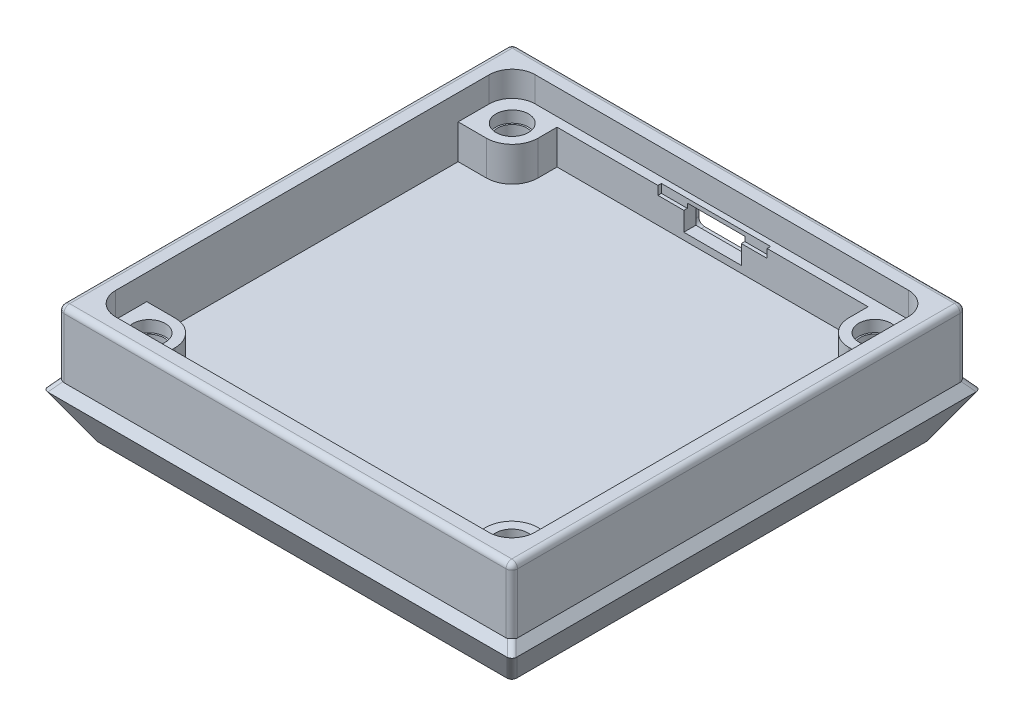
from build123d import *

# Parameters (mm, degrees)
SKETCH1_W               = 72.88
SKETCH1_H               = 72.95
SKETCH1_W_2             = 69.08
SKETCH1_H_2             = 69.15
FLOOR_2_DEPTH           = 10
SKETCH3_W               = 78.88
SKETCH3_H               = 78.95
SKETCH3_W_2             = 72.88
SKETCH3_H_2             = 72.95
WALLS_FROM_BOTTOM_DEPTH = 20.4
SKETCH4_R               = 2.55
BOSS_EXTRUDE1_DEPTH     = 6
SKETCH21_R              = 2.825
CUT_EXTRUDE9_DEPTH      = 2
SKETCH7_W               = 54.075
SKETCH7_H               = 1.6
BOSS_EXTRUDE2_DEPTH     = 6
CUT_EXTRUDE1_DEPTH      = 4.8
CUT_EXTRUDE2_DEPTH      = 88.977702289
SKETCH10_W              = 4.5
SKETCH10_H              = 1.6
CUT_EXTRUDE3_DEPTH      = 1.5
CUT_EXTRUDE4_DEPTH      = 2.5
BOSS_EXTRUDE7_DEPTH     = 87
SKETCH17_W              = 3.751503991
SKETCH17_H              = 9
BOSS_EXTRUDE8_DEPTH     = 91.658299628
CUT_EXTRUDE7_DEPTH      = 105.065434863
CUT_EXTRUDE7_DEPTH_BACK = 105.065434863
CUT_EXTRUDE8_DEPTH      = 96.400760349
CUT_EXTRUDE8_DEPTH_BACK = 96.400760349
FILLET1_R               = 4
FILLET2_R               = 1
FILLET3_R               = 1
BOSS_EXTRUDE9_DEPTH     = 1


with BuildPart() as part:
    # Sketch1 → floor 2 (new body)
    # profile 1 of 2: a face of its own
    with BuildSketch(Plane(origin=(0, 0, 0), x_dir=(1, 0, 0), z_dir=(0, 1, 0))):
        Rectangle(SKETCH1_W, SKETCH1_H)
        Rectangle(SKETCH1_W_2, SKETCH1_H_2, mode=Mode.SUBTRACT)
    # profile 2 of 2: a face of its own
    with BuildSketch(Plane(origin=(0, 0, 0), x_dir=(1, 0, 0), z_dir=(0, 1, 0))):
        Rectangle(SKETCH1_W_2, SKETCH1_H_2)
    extrude(amount=FLOOR_2_DEPTH)

    # Sketch3 → walls from bottom (add)
    with BuildSketch(Plane.XZ):
        Rectangle(SKETCH3_W, SKETCH3_H)
        Rectangle(SKETCH3_W_2, SKETCH3_H_2, mode=Mode.SUBTRACT)
    extrude(amount=-WALLS_FROM_BOTTOM_DEPTH)

    # Sketch4 → Boss-Extrude1 (add)
    # profile 1 of 4: a face of its own
    with BuildSketch(Plane(origin=(0, 10, 0), x_dir=(1, 0, 0), z_dir=(0, 1, 0))):
        with BuildLine():
            Line((-27.0375, -36.475), (-27.0375, -31.575))
            ThreePointArc((-27.0375, -31.575), (-28.355519485, -28.393019485), (-31.5375, -27.075))
            Line((-31.5375, -27.075), (-36.44, -27.075))
            Line((-36.44, -27.075), (-36.44, -36.475))
            Line((-36.44, -36.475), (-27.0375, -36.475))
        make_face()
        with Locations(Location((-31.5375, -31.575, 0), (0, 0, 270))):
            Circle(SKETCH4_R, mode=Mode.SUBTRACT)
    # profile 2 of 4: a face of its own
    with BuildSketch(Plane(origin=(0, 10, 0), x_dir=(1, 0, 0), z_dir=(0, 1, 0))):
        with BuildLine():
            Line((-27.0375, 31.575), (-27.0375, 36.475))
            Line((-27.0375, 36.475), (-36.44, 36.475))
            Line((-36.44, 36.475), (-36.44, 27.075))
            Line((-36.44, 27.075), (-31.5375, 27.075))
            ThreePointArc((-31.5375, 27.075), (-28.355519485, 28.393019485), (-27.0375, 31.575))
        make_face()
        with Locations(Location((-31.5375, 31.575, 0), (0, 0, 270))):
            Circle(SKETCH4_R, mode=Mode.SUBTRACT)
    # profile 3 of 4: a face of its own
    with BuildSketch(Plane(origin=(0, 10, 0), x_dir=(1, 0, 0), z_dir=(0, 1, 0))):
        with BuildLine():
            Line((36.44, -27.075), (31.5375, -27.075))
            ThreePointArc((31.5375, -27.075), (28.355519485, -28.393019485), (27.0375, -31.575))
            Line((27.0375, -31.575), (27.0375, -36.475))
            Line((27.0375, -36.475), (36.44, -36.475))
            Line((36.44, -36.475), (36.44, -27.075))
        make_face()
        with Locations(Location((31.5375, -31.575, 0), (0, 0, 270))):
            Circle(SKETCH4_R, mode=Mode.SUBTRACT)
    # profile 4 of 4: a face of its own
    with BuildSketch(Plane(origin=(0, 10, 0), x_dir=(1, 0, 0), z_dir=(0, 1, 0))):
        with BuildLine():
            Line((31.5375, 27.075), (36.44, 27.075))
            Line((36.44, 27.075), (36.44, 36.475))
            Line((36.44, 36.475), (27.0375, 36.475))
            Line((27.0375, 36.475), (27.0375, 31.575))
            ThreePointArc((27.0375, 31.575), (28.355519485, 28.393019485), (31.5375, 27.075))
        make_face()
        with Locations(Location((31.5375, 31.575, 0), (0, 0, 270))):
            Circle(SKETCH4_R, mode=Mode.SUBTRACT)
    extrude(amount=BOSS_EXTRUDE1_DEPTH)

    # Sketch21 → Cut-Extrude9 (cut)
    with BuildSketch(Plane(origin=(0, 16, 0), x_dir=(1, 0, 0), z_dir=(0, 1, 0))):
        with Locations(Location((-31.5375, 31.575, 0), (0, 0, 270))):
            Circle(SKETCH21_R)
        with Locations(Location((31.5375, 31.575, 0), (0, 0, 270))):
            Circle(SKETCH21_R)
        with Locations(Location((-31.5375, -31.575, 0), (0, 0, 270))):
            Circle(SKETCH21_R)
        with Locations(Location((31.5375, -31.575, 0), (0, 0, 270))):
            Circle(SKETCH21_R)
    extrude(amount=-CUT_EXTRUDE9_DEPTH, mode=Mode.SUBTRACT)

    # Sketch7 → Boss-Extrude2 (add)
    with BuildSketch(Plane(origin=(0, 16, 0), x_dir=(1, 0, 0), z_dir=(0, 1, 0))):
        with Locations((0, 35.675)):
            Rectangle(SKETCH7_W, SKETCH7_H)
    extrude(amount=-BOSS_EXTRUDE2_DEPTH)

    # Sketch8 → Cut-Extrude1 (cut)
    with BuildSketch(Plane(origin=(0, 16, 0), x_dir=(1, 0, 0), z_dir=(0, 1, 0))):
        Polygon((0, 34.875), (-5, 34.875), (-5, 36.475), (0, 36.475), (5, 36.475), (5, 34.875), align=None)
    extrude(amount=-CUT_EXTRUDE1_DEPTH, mode=Mode.SUBTRACT)

    # Sketch9 → Cut-Extrude2 (cut, through all)
    with BuildSketch(Plane.XY.offset(-36.475)):
        Polygon((0, 15.3), (-5, 15.3), (-5, 11.2), (5, 11.2), (5, 15.3), align=None)
    extrude(amount=-CUT_EXTRUDE2_DEPTH, mode=Mode.SUBTRACT)

    # Sketch10 → Cut-Extrude3 (cut)
    with BuildSketch(Plane(origin=(0, 16, 0), x_dir=(1, 0, 0), z_dir=(0, 1, 0))):
        with Locations((-7.25, 35.675)):
            Rectangle(SKETCH10_W, SKETCH10_H)
        with Locations((7.25, 35.675)):
            Rectangle(SKETCH10_W, SKETCH10_H)
    extrude(amount=-CUT_EXTRUDE3_DEPTH, mode=Mode.SUBTRACT)

    # Sketch11 → Cut-Extrude4 (cut)
    with BuildSketch(Plane(origin=(0, 0, -39.475), x_dir=(-1, 0, 0), z_dir=(0, 0, -1))):
        with BuildLine():
            Line((-6, 17.25), (6, 17.25))
            ThreePointArc((6, 17.25), (6.707106781, 16.957106781), (7, 16.25))
            Line((7, 16.25), (7, 10.25))
            ThreePointArc((7, 10.25), (6.707106781, 9.542893219), (6, 9.25))
            Line((6, 9.25), (-6, 9.25))
            ThreePointArc((-6, 9.25), (-6.707106781, 9.542893219), (-7, 10.25))
            Line((-7, 10.25), (-7, 16.25))
            ThreePointArc((-7, 16.25), (-6.707106781, 16.957106781), (-6, 17.25))
        make_face()
    extrude(amount=-CUT_EXTRUDE4_DEPTH, mode=Mode.SUBTRACT)

    # Sketch16 → Boss-Extrude7 (add)
    with BuildSketch(Plane(origin=(0, 0, -39.475), x_dir=(-1, 0, 0), z_dir=(0, 0, -1))):
        Polygon((-39.44, 9), (-46.664968194, 9), (-46.664968194, 0), (44.993331434, 0), (44.993331434, 9), align=None)
    extrude(amount=-BOSS_EXTRUDE7_DEPTH)

    # Sketch17 → Boss-Extrude8 (add)
    with BuildSketch(Plane(origin=(46.664968194, 0, 0), x_dir=(0, 0, -1), z_dir=(1, 0, 0))):
        with Locations((41.350751996, 4.5)):
            Rectangle(SKETCH17_W, SKETCH17_H)
    extrude(amount=-BOSS_EXTRUDE8_DEPTH)

    # Sketch19 → Cut-Extrude7 (cut, two sides: drawn at the far end of the back side and taken through both)
    with BuildSketch(Plane(origin=(0, 0, -43.226503991), x_dir=(-1, 0, 0), z_dir=(0, 0, -1)).offset(-CUT_EXTRUDE7_DEPTH_BACK)):
        Polygon((-39.44, 9), (-40.725575219, 7.467911114), (-36.413974728, 0), (-50.627320284, 0), (-50.627320284, 9), align=None)
        Polygon((39.44, 9), (40.725575219, 7.467911114), (36.413974728, 0), (59.328992784, 0), (59.328992784, 9), align=None)
    extrude(amount=CUT_EXTRUDE7_DEPTH + CUT_EXTRUDE7_DEPTH_BACK, mode=Mode.SUBTRACT)

    # Sketch20 → Cut-Extrude8 (cut, two sides: drawn at the far end of the back side and taken through both)
    with BuildSketch(Plane(origin=(39.44, 0, 0), x_dir=(0, 0, -1), z_dir=(1, 0, 0)).offset(-CUT_EXTRUDE8_DEPTH_BACK)):
        Polygon((-39.475, 9), (-40.760575219, 7.467911114), (-36.448974728, 0), (-51.446524264, 0), (-51.446524264, 9), align=None)
        Polygon((39.475, 9), (40.760575219, 7.467911114), (36.448974728, 0), (51.519098664, 0), (51.519098664, 9), align=None)
    extrude(amount=CUT_EXTRUDE8_DEPTH + CUT_EXTRUDE8_DEPTH_BACK, mode=Mode.SUBTRACT)

    # Fillet1
    fillet1_edges = [part.edges().sort_by_distance(p)[0] for p in [
        (36.44, 18.2, -36.475),
        (-36.44, 18.2, -36.475),
        (-36.44, 18.2, 36.475),
        (36.44, 18.2, 36.475),
    ]]
    fillet(fillet1_edges, radius=FILLET1_R)

    # Fillet2
    # the kernel refuses this fillet: 1 mm, written as the material it takes off along each edge
    with BuildSketch(Plane(origin=(39.44, 6.5, 39.475), x_dir=(0, 0, -1), z_dir=(0, 1, 0))) as fillet2_piece_1_section:
        with BuildLine():
            CenterArc((FILLET2_R, FILLET2_R), FILLET2_R, 180, 90)
            Line((0, FILLET2_R), (0, 0))
            Line((0, 0), (FILLET2_R, 0))
        make_face()
    fillet2_piece_1 = extrude(amount=16.4, mode=Mode.PRIVATE)
    fillet2_piece_1 = split(fillet2_piece_1, bisect_by=Plane(origin=(39.053654756, 9.460428332, 39.432018042), z_dir=(-0.7660444431189769, -0.6427876096865407, 0)), keep=Keep.TOP, mode=Mode.PRIVATE)
    fillet2_piece_1 = split(fillet2_piece_1, bisect_by=Plane(origin=(38.911072473, 9.221146851, 39.289435759), z_dir=(0, 0.6427876096865407, 0.7660444431189769)), keep=Keep.TOP, mode=Mode.PRIVATE)
    add(fillet2_piece_1, mode=Mode.SUBTRACT)
    with BuildSketch(Plane(origin=(39.44, 6.5, 39.475), x_dir=(0, 0, -1), z_dir=(0, 1, 0))) as fillet2_piece_2_section:
        with BuildLine():
            CenterArc((FILLET2_R, FILLET2_R), FILLET2_R, 180, 90)
            Line((0, FILLET2_R), (0, 0))
            Line((0, 0), (FILLET2_R, 0))
        make_face()
    fillet2_piece_2 = extrude(amount=16.4, mode=Mode.PRIVATE)
    fillet2_piece_2 = split(fillet2_piece_2, bisect_by=Plane(origin=(39.254435759, 9.221146851, 38.946072473), z_dir=(0.7660444431189769, 0.6427876096865407, 0)), keep=Keep.TOP, mode=Mode.PRIVATE)
    fillet2_piece_2 = split(fillet2_piece_2, bisect_by=Plane(origin=(39.397018042, 9.460428332, 39.088654756), z_dir=(0, -0.6427876096865407, -0.7660444431189769)), keep=Keep.TOP, mode=Mode.PRIVATE)
    add(fillet2_piece_2, mode=Mode.SUBTRACT)
    with BuildSketch(Plane(origin=(39.44, 6.5, 39.475), x_dir=(0, 0, -1), z_dir=(0, 1, 0))) as fillet2_piece_3_section:
        with BuildLine():
            CenterArc((FILLET2_R, FILLET2_R), FILLET2_R, 180, 90)
            Line((0, FILLET2_R), (0, 0))
            Line((0, 0), (FILLET2_R, 0))
        make_face()
    fillet2_piece_3 = extrude(amount=16.4, mode=Mode.PRIVATE)
    fillet2_piece_3 = split(fillet2_piece_3, bisect_by=Plane(origin=(35.814942062, 13.32017582, 39.250250579), z_dir=(0.7660444431189769, 0.6427876096865407, 0)), keep=Keep.TOP, mode=Mode.PRIVATE)
    fillet2_piece_3 = split(fillet2_piece_3, bisect_by=Plane(origin=(39.215250579, 13.32017582, 35.849942062), z_dir=(0, 0.6427876096865407, 0.7660444431189769)), keep=Keep.TOP, mode=Mode.PRIVATE)
    add(fillet2_piece_3, mode=Mode.SUBTRACT)
    with BuildSketch(Plane(origin=(39.44, 6.5, -39.475), x_dir=(-1, 0, 0), z_dir=(0, 1, 0))) as fillet2_piece_4_section:
        with BuildLine():
            CenterArc((FILLET2_R, FILLET2_R), FILLET2_R, 180, 90)
            Line((0, FILLET2_R), (0, 0))
            Line((0, 0), (FILLET2_R, 0))
        make_face()
    fillet2_piece_4 = extrude(amount=16.4, mode=Mode.PRIVATE)
    fillet2_piece_4 = split(fillet2_piece_4, bisect_by=Plane(origin=(39.397018042, 9.460428332, -39.088654756), z_dir=(0, -0.6427876096865407, 0.7660444431189769)), keep=Keep.TOP, mode=Mode.PRIVATE)
    fillet2_piece_4 = split(fillet2_piece_4, bisect_by=Plane(origin=(39.254435759, 9.221146851, -38.946072473), z_dir=(0.7660444431189769, 0.6427876096865407, 0)), keep=Keep.TOP, mode=Mode.PRIVATE)
    add(fillet2_piece_4, mode=Mode.SUBTRACT)
    with BuildSketch(Plane(origin=(39.44, 6.5, -39.475), x_dir=(-1, 0, 0), z_dir=(0, 1, 0))) as fillet2_piece_5_section:
        with BuildLine():
            CenterArc((FILLET2_R, FILLET2_R), FILLET2_R, 180, 90)
            Line((0, FILLET2_R), (0, 0))
            Line((0, 0), (FILLET2_R, 0))
        make_face()
    fillet2_piece_5 = extrude(amount=16.4, mode=Mode.PRIVATE)
    fillet2_piece_5 = split(fillet2_piece_5, bisect_by=Plane(origin=(38.911072473, 9.221146851, -39.289435759), z_dir=(0, 0.6427876096865407, -0.7660444431189769)), keep=Keep.TOP, mode=Mode.PRIVATE)
    fillet2_piece_5 = split(fillet2_piece_5, bisect_by=Plane(origin=(39.053654756, 9.460428332, -39.432018042), z_dir=(-0.7660444431189769, -0.6427876096865407, 0)), keep=Keep.TOP, mode=Mode.PRIVATE)
    add(fillet2_piece_5, mode=Mode.SUBTRACT)
    with BuildSketch(Plane(origin=(39.44, 6.5, -39.475), x_dir=(-1, 0, 0), z_dir=(0, 1, 0))) as fillet2_piece_6_section:
        with BuildLine():
            CenterArc((FILLET2_R, FILLET2_R), FILLET2_R, 180, 90)
            Line((0, FILLET2_R), (0, 0))
            Line((0, 0), (FILLET2_R, 0))
        make_face()
    fillet2_piece_6 = extrude(amount=16.4, mode=Mode.PRIVATE)
    fillet2_piece_6 = split(fillet2_piece_6, bisect_by=Plane(origin=(39.215250579, 13.32017582, -35.849942062), z_dir=(0, 0.6427876096865407, -0.7660444431189769)), keep=Keep.TOP, mode=Mode.PRIVATE)
    fillet2_piece_6 = split(fillet2_piece_6, bisect_by=Plane(origin=(35.814942062, 13.32017582, -39.250250579), z_dir=(0.7660444431189769, 0.6427876096865407, 0)), keep=Keep.TOP, mode=Mode.PRIVATE)
    add(fillet2_piece_6, mode=Mode.SUBTRACT)
    with BuildSketch(Plane(origin=(-39.44, 6.5, -39.475), x_dir=(1, 0, 0), z_dir=(0, 1, 0))) as fillet2_piece_7_section:
        with BuildLine():
            CenterArc((FILLET2_R, -FILLET2_R), FILLET2_R, 90, 90)
            Line((0, -FILLET2_R), (0, 0))
            Line((0, 0), (FILLET2_R, 0))
        make_face()
    fillet2_piece_7 = extrude(amount=16.4, mode=Mode.PRIVATE)
    fillet2_piece_7 = split(fillet2_piece_7, bisect_by=Plane(origin=(-39.397018042, 9.460428332, -39.088654756), z_dir=(0, -0.6427876096865407, 0.7660444431189769)), keep=Keep.TOP, mode=Mode.PRIVATE)
    fillet2_piece_7 = split(fillet2_piece_7, bisect_by=Plane(origin=(-39.254435759, 9.221146851, -38.946072473), z_dir=(-0.7660444431189777, 0.6427876096865398, 0)), keep=Keep.TOP, mode=Mode.PRIVATE)
    add(fillet2_piece_7, mode=Mode.SUBTRACT)
    with BuildSketch(Plane(origin=(-39.44, 6.5, -39.475), x_dir=(1, 0, 0), z_dir=(0, 1, 0))) as fillet2_piece_8_section:
        with BuildLine():
            CenterArc((FILLET2_R, -FILLET2_R), FILLET2_R, 90, 90)
            Line((0, -FILLET2_R), (0, 0))
            Line((0, 0), (FILLET2_R, 0))
        make_face()
    fillet2_piece_8 = extrude(amount=16.4, mode=Mode.PRIVATE)
    fillet2_piece_8 = split(fillet2_piece_8, bisect_by=Plane(origin=(-38.911072473, 9.221146851, -39.289435759), z_dir=(0, 0.6427876096865407, -0.7660444431189769)), keep=Keep.TOP, mode=Mode.PRIVATE)
    fillet2_piece_8 = split(fillet2_piece_8, bisect_by=Plane(origin=(-39.053654756, 9.460428332, -39.432018042), z_dir=(0.7660444431189777, -0.6427876096865398, 0)), keep=Keep.TOP, mode=Mode.PRIVATE)
    add(fillet2_piece_8, mode=Mode.SUBTRACT)
    with BuildSketch(Plane(origin=(-39.44, 6.5, -39.475), x_dir=(1, 0, 0), z_dir=(0, 1, 0))) as fillet2_piece_9_section:
        with BuildLine():
            CenterArc((FILLET2_R, -FILLET2_R), FILLET2_R, 90, 90)
            Line((0, -FILLET2_R), (0, 0))
            Line((0, 0), (FILLET2_R, 0))
        make_face()
    fillet2_piece_9 = extrude(amount=16.4, mode=Mode.PRIVATE)
    fillet2_piece_9 = split(fillet2_piece_9, bisect_by=Plane(origin=(-39.215250579, 13.32017582, -35.849942062), z_dir=(0, 0.6427876096865407, -0.7660444431189769)), keep=Keep.TOP, mode=Mode.PRIVATE)
    fillet2_piece_9 = split(fillet2_piece_9, bisect_by=Plane(origin=(-35.814942062, 13.32017582, -39.250250579), z_dir=(-0.7660444431189777, 0.6427876096865398, 0)), keep=Keep.TOP, mode=Mode.PRIVATE)
    add(fillet2_piece_9, mode=Mode.SUBTRACT)
    with BuildSketch(Plane(origin=(-39.44, 6.5, 39.475), x_dir=(1, 0, 0), z_dir=(0, 1, 0))) as fillet2_piece_10_section:
        with BuildLine():
            CenterArc((FILLET2_R, FILLET2_R), FILLET2_R, 180, 90)
            Line((0, FILLET2_R), (0, 0))
            Line((0, 0), (FILLET2_R, 0))
        make_face()
    fillet2_piece_10 = extrude(amount=16.4, mode=Mode.PRIVATE)
    fillet2_piece_10 = split(fillet2_piece_10, bisect_by=Plane(origin=(-39.397018042, 9.460428332, 39.088654756), z_dir=(0, -0.6427876096865407, -0.7660444431189769)), keep=Keep.TOP, mode=Mode.PRIVATE)
    fillet2_piece_10 = split(fillet2_piece_10, bisect_by=Plane(origin=(-39.254435759, 9.221146851, 38.946072473), z_dir=(-0.7660444431189777, 0.6427876096865398, 0)), keep=Keep.TOP, mode=Mode.PRIVATE)
    add(fillet2_piece_10, mode=Mode.SUBTRACT)
    with BuildSketch(Plane(origin=(-39.44, 6.5, 39.475), x_dir=(1, 0, 0), z_dir=(0, 1, 0))) as fillet2_piece_11_section:
        with BuildLine():
            CenterArc((FILLET2_R, FILLET2_R), FILLET2_R, 180, 90)
            Line((0, FILLET2_R), (0, 0))
            Line((0, 0), (FILLET2_R, 0))
        make_face()
    fillet2_piece_11 = extrude(amount=16.4, mode=Mode.PRIVATE)
    fillet2_piece_11 = split(fillet2_piece_11, bisect_by=Plane(origin=(-38.911072473, 9.221146851, 39.289435759), z_dir=(0, 0.6427876096865407, 0.7660444431189769)), keep=Keep.TOP, mode=Mode.PRIVATE)
    fillet2_piece_11 = split(fillet2_piece_11, bisect_by=Plane(origin=(-39.053654756, 9.460428332, 39.432018042), z_dir=(0.7660444431189777, -0.6427876096865398, 0)), keep=Keep.TOP, mode=Mode.PRIVATE)
    add(fillet2_piece_11, mode=Mode.SUBTRACT)
    with BuildSketch(Plane(origin=(-39.44, 6.5, 39.475), x_dir=(1, 0, 0), z_dir=(0, 1, 0))) as fillet2_piece_12_section:
        with BuildLine():
            CenterArc((FILLET2_R, FILLET2_R), FILLET2_R, 180, 90)
            Line((0, FILLET2_R), (0, 0))
            Line((0, 0), (FILLET2_R, 0))
        make_face()
    fillet2_piece_12 = extrude(amount=16.4, mode=Mode.PRIVATE)
    fillet2_piece_12 = split(fillet2_piece_12, bisect_by=Plane(origin=(-39.215250579, 13.32017582, 35.849942062), z_dir=(0, 0.6427876096865407, 0.7660444431189769)), keep=Keep.TOP, mode=Mode.PRIVATE)
    fillet2_piece_12 = split(fillet2_piece_12, bisect_by=Plane(origin=(-35.814942062, 13.32017582, 39.250250579), z_dir=(-0.7660444431189777, 0.6427876096865398, 0)), keep=Keep.TOP, mode=Mode.PRIVATE)
    add(fillet2_piece_12, mode=Mode.SUBTRACT)
    with BuildSketch(Plane(origin=(41.591600623, 8.967911114, -41.626600623), x_dir=(-0.8944271909999146, 0.38729833462074476, -0.223606797749979), z_dir=(-0.44721359549996054, -0.7745966692414817, 0.4472135954999582)), Plane(origin=(41.591600623, 8.967911114, 41.626600623), x_dir=(0.22360679774998082, 0.3872983346207411, -0.8944271909999156), z_dir=(-0.4472135954999606, -0.7745966692414817, -0.4472135954999583)), Plane(origin=(-41.591600623, 8.967911114, 41.626600623), x_dir=(0.8944271909999153, 0.3872983346207435, 0.22360679774997824), z_dir=(0.44721359549995915, -0.7745966692414824, -0.4472135954999586))) as fillet2_piece_13:
        with BuildLine():
            CenterArc((FILLET2_R * 0.774596669241, -FILLET2_R), FILLET2_R, 90, 75.522487814)
            Line((-FILLET2_R * 0.19364916731, -FILLET2_R * 0.75), (0, 0))
            Line((0, 0), (FILLET2_R * 0.774596669241, 0))
        make_face()
    extrude(amount=13.514015138, mode=Mode.SUBTRACT)
    with BuildSketch(Plane(origin=(38.568905551, 10.038129939, -38.603905551), x_dir=(-0.8412050806713919, -0.41421264265922036, -0.3475656756843261), z_dir=(0.5407162030609376, -0.6444004775717704, -0.5407162030609376))) as fillet2_piece_14_section:
        with BuildLine():
            CenterArc((FILLET2_R * 0.644400477572, -FILLET2_R), FILLET2_R, 90, 65.595502662)
            Line((-FILLET2_R * 0.266250754477, -FILLET2_R * 0.586824088833), (0, 0))
            Line((0, 0), (FILLET2_R * 0.644400477572, 0))
        make_face()
    fillet2_piece_14 = extrude(amount=5.599543901, mode=Mode.PRIVATE)
    fillet2_piece_14 = split(fillet2_piece_14, bisect_by=Plane(origin=(39.638757158, 8.739688685, -39.475), z_dir=(0, 0, 1)), keep=Keep.TOP, mode=Mode.PRIVATE)
    fillet2_piece_14 = split(fillet2_piece_14, bisect_by=Plane(origin=(39.44, 8.739688685, -39.276242842), z_dir=(1, 0, 0)), keep=Keep.TOP, mode=Mode.PRIVATE)
    add(fillet2_piece_14, mode=Mode.SUBTRACT)
    with BuildSketch(Plane(origin=(38.568905551, 10.038129939, -38.603905551), x_dir=(-0.8412050806713919, -0.41421264265922036, -0.3475656756843261), z_dir=(0.5407162030609376, -0.6444004775717704, -0.5407162030609376))) as fillet2_piece_15_section:
        with BuildLine():
            CenterArc((FILLET2_R * 0.644400477572, -FILLET2_R), FILLET2_R, 90, 65.595502662)
            Line((-FILLET2_R * 0.266250754477, -FILLET2_R * 0.586824088833), (0, 0))
            Line((0, 0), (FILLET2_R * 0.644400477572, 0))
        make_face()
    fillet2_piece_15 = extrude(amount=5.599543901, mode=Mode.PRIVATE)
    fillet2_piece_15 = split(fillet2_piece_15, bisect_by=Plane(origin=(39.241242842, 8.739688685, -39.475), z_dir=(0, 0, -1)), keep=Keep.TOP, mode=Mode.PRIVATE)
    fillet2_piece_15 = split(fillet2_piece_15, bisect_by=Plane(origin=(39.44, 8.739688685, -39.673757158), z_dir=(-1, 0, 0)), keep=Keep.TOP, mode=Mode.PRIVATE)
    add(fillet2_piece_15, mode=Mode.SUBTRACT)
    with BuildSketch(Plane(origin=(38.568905551, 10.038129939, -38.603905551), x_dir=(-0.8412050806713919, -0.41421264265922036, -0.3475656756843261), z_dir=(0.5407162030609376, -0.6444004775717704, -0.5407162030609376))) as fillet2_piece_16_section:
        with BuildLine():
            CenterArc((FILLET2_R * 0.644400477572, -FILLET2_R), FILLET2_R, 90, 65.595502662)
            Line((-FILLET2_R * 0.266250754477, -FILLET2_R * 0.586824088833), (0, 0))
            Line((0, 0), (FILLET2_R * 0.644400477572, 0))
        make_face()
    fillet2_piece_16 = extrude(amount=5.599543901, mode=Mode.PRIVATE)
    fillet2_piece_16 = split(fillet2_piece_16, bisect_by=Plane(origin=(40.543608785, 7.491124001, -39.475), z_dir=(0, 0, -1)), keep=Keep.TOP, mode=Mode.PRIVATE)
    fillet2_piece_16 = split(fillet2_piece_16, bisect_by=Plane(origin=(39.44, 7.491124001, -40.578608785), z_dir=(1, 0, 0)), keep=Keep.TOP, mode=Mode.PRIVATE)
    add(fillet2_piece_16, mode=Mode.SUBTRACT)
    with BuildSketch(Plane(origin=(38.568905551, 10.038129939, 38.603905551), x_dir=(0.3475656756843197, -0.41421264265922575, -0.841205080671392), z_dir=(0.5407162030609376, -0.6444004775717704, 0.5407162030609376))) as fillet2_piece_17_section:
        with BuildLine():
            CenterArc((FILLET2_R * 0.644400477572, -FILLET2_R), FILLET2_R, 90, 65.595502662)
            Line((-FILLET2_R * 0.266250754477, -FILLET2_R * 0.586824088833), (0, 0))
            Line((0, 0), (FILLET2_R * 0.644400477572, 0))
        make_face()
    fillet2_piece_17 = extrude(amount=5.599543901, mode=Mode.PRIVATE)
    fillet2_piece_17 = split(fillet2_piece_17, bisect_by=Plane(origin=(39.44, 8.739688685, 39.673757158), z_dir=(-1, 0, 0)), keep=Keep.TOP, mode=Mode.PRIVATE)
    fillet2_piece_17 = split(fillet2_piece_17, bisect_by=Plane(origin=(39.241242842, 8.739688685, 39.475), z_dir=(0, 0, 1)), keep=Keep.TOP, mode=Mode.PRIVATE)
    add(fillet2_piece_17, mode=Mode.SUBTRACT)
    with BuildSketch(Plane(origin=(38.568905551, 10.038129939, 38.603905551), x_dir=(0.3475656756843197, -0.41421264265922575, -0.841205080671392), z_dir=(0.5407162030609376, -0.6444004775717704, 0.5407162030609376))) as fillet2_piece_18_section:
        with BuildLine():
            CenterArc((FILLET2_R * 0.644400477572, -FILLET2_R), FILLET2_R, 90, 65.595502662)
            Line((-FILLET2_R * 0.266250754477, -FILLET2_R * 0.586824088833), (0, 0))
            Line((0, 0), (FILLET2_R * 0.644400477572, 0))
        make_face()
    fillet2_piece_18 = extrude(amount=5.599543901, mode=Mode.PRIVATE)
    fillet2_piece_18 = split(fillet2_piece_18, bisect_by=Plane(origin=(39.44, 8.739688685, 39.276242842), z_dir=(1, 0, 0)), keep=Keep.TOP, mode=Mode.PRIVATE)
    fillet2_piece_18 = split(fillet2_piece_18, bisect_by=Plane(origin=(39.638757158, 8.739688685, 39.475), z_dir=(0, 0, -1)), keep=Keep.TOP, mode=Mode.PRIVATE)
    add(fillet2_piece_18, mode=Mode.SUBTRACT)
    with BuildSketch(Plane(origin=(38.568905551, 10.038129939, 38.603905551), x_dir=(0.3475656756843197, -0.41421264265922575, -0.841205080671392), z_dir=(0.5407162030609376, -0.6444004775717704, 0.5407162030609376))) as fillet2_piece_19_section:
        with BuildLine():
            CenterArc((FILLET2_R * 0.644400477572, -FILLET2_R), FILLET2_R, 90, 65.595502662)
            Line((-FILLET2_R * 0.266250754477, -FILLET2_R * 0.586824088833), (0, 0))
            Line((0, 0), (FILLET2_R * 0.644400477572, 0))
        make_face()
    fillet2_piece_19 = extrude(amount=5.599543901, mode=Mode.PRIVATE)
    fillet2_piece_19 = split(fillet2_piece_19, bisect_by=Plane(origin=(39.44, 7.491124001, 40.578608785), z_dir=(1, 0, 0)), keep=Keep.TOP, mode=Mode.PRIVATE)
    fillet2_piece_19 = split(fillet2_piece_19, bisect_by=Plane(origin=(40.543608785, 7.491124001, 39.475), z_dir=(0, 0, 1)), keep=Keep.TOP, mode=Mode.PRIVATE)
    add(fillet2_piece_19, mode=Mode.SUBTRACT)
    with BuildSketch(Plane(origin=(-38.568905551, 10.038129939, 38.603905551), x_dir=(0.8412050806713924, -0.4142126426592251, 0.34756567568431906), z_dir=(-0.5407162030609367, -0.644400477571771, 0.5407162030609379))) as fillet2_piece_20_section:
        with BuildLine():
            CenterArc((FILLET2_R * 0.644400477572, -FILLET2_R), FILLET2_R, 90, 65.595502662)
            Line((-FILLET2_R * 0.266250754477, -FILLET2_R * 0.586824088833), (0, 0))
            Line((0, 0), (FILLET2_R * 0.644400477572, 0))
        make_face()
    fillet2_piece_20 = extrude(amount=5.599543901, mode=Mode.PRIVATE)
    fillet2_piece_20 = split(fillet2_piece_20, bisect_by=Plane(origin=(-39.638757158, 8.739688685, 39.475), z_dir=(0, 0, -1)), keep=Keep.TOP, mode=Mode.PRIVATE)
    fillet2_piece_20 = split(fillet2_piece_20, bisect_by=Plane(origin=(-39.44, 8.739688685, 39.276242842), z_dir=(-1, 0, 0)), keep=Keep.TOP, mode=Mode.PRIVATE)
    add(fillet2_piece_20, mode=Mode.SUBTRACT)
    with BuildSketch(Plane(origin=(-38.568905551, 10.038129939, 38.603905551), x_dir=(0.8412050806713924, -0.4142126426592251, 0.34756567568431906), z_dir=(-0.5407162030609367, -0.644400477571771, 0.5407162030609379))) as fillet2_piece_21_section:
        with BuildLine():
            CenterArc((FILLET2_R * 0.644400477572, -FILLET2_R), FILLET2_R, 90, 65.595502662)
            Line((-FILLET2_R * 0.266250754477, -FILLET2_R * 0.586824088833), (0, 0))
            Line((0, 0), (FILLET2_R * 0.644400477572, 0))
        make_face()
    fillet2_piece_21 = extrude(amount=5.599543901, mode=Mode.PRIVATE)
    fillet2_piece_21 = split(fillet2_piece_21, bisect_by=Plane(origin=(-39.241242842, 8.739688685, 39.475), z_dir=(0, 0, 1)), keep=Keep.TOP, mode=Mode.PRIVATE)
    fillet2_piece_21 = split(fillet2_piece_21, bisect_by=Plane(origin=(-39.44, 8.739688685, 39.673757158), z_dir=(1, 0, 0)), keep=Keep.TOP, mode=Mode.PRIVATE)
    add(fillet2_piece_21, mode=Mode.SUBTRACT)
    with BuildSketch(Plane(origin=(-38.568905551, 10.038129939, 38.603905551), x_dir=(0.8412050806713924, -0.4142126426592251, 0.34756567568431906), z_dir=(-0.5407162030609367, -0.644400477571771, 0.5407162030609379))) as fillet2_piece_22_section:
        with BuildLine():
            CenterArc((FILLET2_R * 0.644400477572, -FILLET2_R), FILLET2_R, 90, 65.595502662)
            Line((-FILLET2_R * 0.266250754477, -FILLET2_R * 0.586824088833), (0, 0))
            Line((0, 0), (FILLET2_R * 0.644400477572, 0))
        make_face()
    fillet2_piece_22 = extrude(amount=5.599543901, mode=Mode.PRIVATE)
    fillet2_piece_22 = split(fillet2_piece_22, bisect_by=Plane(origin=(-40.543608785, 7.491124001, 39.475), z_dir=(0, 0, 1)), keep=Keep.TOP, mode=Mode.PRIVATE)
    fillet2_piece_22 = split(fillet2_piece_22, bisect_by=Plane(origin=(-39.44, 7.491124001, 40.578608785), z_dir=(-1, 0, 0)), keep=Keep.TOP, mode=Mode.PRIVATE)
    add(fillet2_piece_22, mode=Mode.SUBTRACT)
    with BuildSketch(Plane(origin=(-38.568905551, 10.038129939, -38.603905551), x_dir=(0.8412050806713924, -0.4142126426592251, -0.34756567568431906), z_dir=(-0.5407162030609367, -0.6444004775717709, -0.540716203060938))) as fillet2_piece_23_section:
        with BuildLine():
            CenterArc((FILLET2_R * 0.644400477572, FILLET2_R), FILLET2_R, 204.404497338, 65.595502662)
            Line((-FILLET2_R * 0.266250754477, FILLET2_R * 0.586824088833), (0, 0))
            Line((0, 0), (FILLET2_R * 0.644400477572, 0))
        make_face()
    fillet2_piece_23 = extrude(amount=5.599543901, mode=Mode.PRIVATE)
    fillet2_piece_23 = split(fillet2_piece_23, bisect_by=Plane(origin=(-39.638757158, 8.739688685, -39.475), z_dir=(0, 0, 1)), keep=Keep.TOP, mode=Mode.PRIVATE)
    fillet2_piece_23 = split(fillet2_piece_23, bisect_by=Plane(origin=(-39.44, 8.739688685, -39.276242842), z_dir=(-1, 0, 0)), keep=Keep.TOP, mode=Mode.PRIVATE)
    add(fillet2_piece_23, mode=Mode.SUBTRACT)
    with BuildSketch(Plane(origin=(-38.568905551, 10.038129939, -38.603905551), x_dir=(0.8412050806713924, -0.4142126426592251, -0.34756567568431906), z_dir=(-0.5407162030609367, -0.6444004775717709, -0.540716203060938))) as fillet2_piece_24_section:
        with BuildLine():
            CenterArc((FILLET2_R * 0.644400477572, FILLET2_R), FILLET2_R, 204.404497338, 65.595502662)
            Line((-FILLET2_R * 0.266250754477, FILLET2_R * 0.586824088833), (0, 0))
            Line((0, 0), (FILLET2_R * 0.644400477572, 0))
        make_face()
    fillet2_piece_24 = extrude(amount=5.599543901, mode=Mode.PRIVATE)
    fillet2_piece_24 = split(fillet2_piece_24, bisect_by=Plane(origin=(-39.241242842, 8.739688685, -39.475), z_dir=(0, 0, -1)), keep=Keep.TOP, mode=Mode.PRIVATE)
    fillet2_piece_24 = split(fillet2_piece_24, bisect_by=Plane(origin=(-39.44, 8.739688685, -39.673757158), z_dir=(1, 0, 0)), keep=Keep.TOP, mode=Mode.PRIVATE)
    add(fillet2_piece_24, mode=Mode.SUBTRACT)
    with BuildSketch(Plane(origin=(-38.568905551, 10.038129939, -38.603905551), x_dir=(0.8412050806713924, -0.4142126426592251, -0.34756567568431906), z_dir=(-0.5407162030609367, -0.6444004775717709, -0.540716203060938))) as fillet2_piece_25_section:
        with BuildLine():
            CenterArc((FILLET2_R * 0.644400477572, FILLET2_R), FILLET2_R, 204.404497338, 65.595502662)
            Line((-FILLET2_R * 0.266250754477, FILLET2_R * 0.586824088833), (0, 0))
            Line((0, 0), (FILLET2_R * 0.644400477572, 0))
        make_face()
    fillet2_piece_25 = extrude(amount=5.599543901, mode=Mode.PRIVATE)
    fillet2_piece_25 = split(fillet2_piece_25, bisect_by=Plane(origin=(-40.543608785, 7.491124001, -39.475), z_dir=(0, 0, -1)), keep=Keep.TOP, mode=Mode.PRIVATE)
    fillet2_piece_25 = split(fillet2_piece_25, bisect_by=Plane(origin=(-39.44, 7.491124001, -40.578608785), z_dir=(-1, 0, 0)), keep=Keep.TOP, mode=Mode.PRIVATE)
    add(fillet2_piece_25, mode=Mode.SUBTRACT)
    with BuildSketch(Plane(origin=(-41.591600623, 8.967911114, -41.626600623), x_dir=(0.8944271909999153, 0.3872983346207435, -0.22360679774997824), z_dir=(0.4472135954999591, -0.7745966692414823, 0.44721359549995865))) as fillet2_piece_26:
        with BuildLine():
            CenterArc((FILLET2_R * 0.774596669241, FILLET2_R), FILLET2_R, 194.477512186, 75.522487814)
            Line((-FILLET2_R * 0.19364916731, FILLET2_R * 0.75), (0, 0))
            Line((0, 0), (FILLET2_R * 0.774596669241, 0))
        make_face()
    extrude(amount=13.514015138, mode=Mode.SUBTRACT)
    with BuildSketch(Plane(origin=(39.44, 6.5, 39.475), x_dir=(0, 0, -1), z_dir=(0, 1, 0))) as fillet2_piece_27a_section:
        with BuildLine():
            CenterArc((FILLET2_R, FILLET2_R), FILLET2_R, 180, 90)
            Line((0, FILLET2_R), (0, 0))
            Line((0, 0), (FILLET2_R, 0))
        make_face()
    fillet2_piece_27a = extrude(amount=16.4, mode=Mode.PRIVATE)
    fillet2_piece_27a = split(fillet2_piece_27a, bisect_by=Plane(origin=(39.939388908, 8.404851475, 39.248398456), z_dir=(-0.7660444431189769, -0.6427876096865407, 0)), keep=Keep.TOP, mode=Mode.PRIVATE)
    fillet2_piece_27a = split(fillet2_piece_27a, bisect_by=Plane(origin=(39.213398456, 8.404851475, 39.974388908), z_dir=(0, -0.6427876096865407, -0.7660444431189769)), keep=Keep.TOP, mode=Mode.PRIVATE)
    with BuildSketch(Plane(origin=(38.568905551, 10.038129939, 38.603905551), x_dir=(0.3475656756843197, -0.41421264265922575, -0.841205080671392), z_dir=(0.5407162030609376, -0.6444004775717704, 0.5407162030609376))) as fillet2_piece_27b_section:
        with BuildLine():
            CenterArc((FILLET2_R * 0.644400477572, -FILLET2_R), FILLET2_R, 90, 65.595502662)
            Line((-FILLET2_R * 0.266250754477, -FILLET2_R * 0.586824088833), (0, 0))
            Line((0, 0), (FILLET2_R * 0.644400477572, 0))
        make_face()
    fillet2_piece_27b = extrude(amount=5.599543901, mode=Mode.PRIVATE)
    fillet2_piece_27b = split(fillet2_piece_27b, bisect_by=Plane(origin=(39.44, 9.43474013, 38.947726533), z_dir=(-1, 0, 0)), keep=Keep.TOP, mode=Mode.PRIVATE)
    fillet2_piece_27b = split(fillet2_piece_27b, bisect_by=Plane(origin=(38.912726533, 9.43474013, 39.475), z_dir=(0, 0, -1)), keep=Keep.TOP, mode=Mode.PRIVATE)
    fillet2_piece_27 = fillet2_piece_27a & fillet2_piece_27b
    add(fillet2_piece_27, mode=Mode.SUBTRACT)
    with BuildSketch(Plane(origin=(39.44, 6.5, -39.475), x_dir=(-1, 0, 0), z_dir=(0, 1, 0))) as fillet2_piece_28a_section:
        with BuildLine():
            CenterArc((FILLET2_R, FILLET2_R), FILLET2_R, 180, 90)
            Line((0, FILLET2_R), (0, 0))
            Line((0, 0), (FILLET2_R, 0))
        make_face()
    fillet2_piece_28a = extrude(amount=16.4, mode=Mode.PRIVATE)
    fillet2_piece_28a = split(fillet2_piece_28a, bisect_by=Plane(origin=(39.213398456, 8.404851475, -39.974388908), z_dir=(0, -0.6427876096865407, 0.7660444431189769)), keep=Keep.TOP, mode=Mode.PRIVATE)
    fillet2_piece_28a = split(fillet2_piece_28a, bisect_by=Plane(origin=(39.939388908, 8.404851475, -39.248398456), z_dir=(-0.7660444431189769, -0.6427876096865407, 0)), keep=Keep.TOP, mode=Mode.PRIVATE)
    with BuildSketch(Plane(origin=(38.568905551, 10.038129939, -38.603905551), x_dir=(-0.8412050806713919, -0.41421264265922036, -0.3475656756843261), z_dir=(0.5407162030609376, -0.6444004775717704, -0.5407162030609376))) as fillet2_piece_28b_section:
        with BuildLine():
            CenterArc((FILLET2_R * 0.644400477572, -FILLET2_R), FILLET2_R, 90, 65.595502662)
            Line((-FILLET2_R * 0.266250754477, -FILLET2_R * 0.586824088833), (0, 0))
            Line((0, 0), (FILLET2_R * 0.644400477572, 0))
        make_face()
    fillet2_piece_28b = extrude(amount=5.599543901, mode=Mode.PRIVATE)
    fillet2_piece_28b = split(fillet2_piece_28b, bisect_by=Plane(origin=(38.912726533, 9.43474013, -39.475), z_dir=(0, 0, 1)), keep=Keep.TOP, mode=Mode.PRIVATE)
    fillet2_piece_28b = split(fillet2_piece_28b, bisect_by=Plane(origin=(39.44, 9.43474013, -38.947726533), z_dir=(-1, 0, 0)), keep=Keep.TOP, mode=Mode.PRIVATE)
    fillet2_piece_28 = fillet2_piece_28a & fillet2_piece_28b
    add(fillet2_piece_28, mode=Mode.SUBTRACT)
    with BuildSketch(Plane(origin=(-39.44, 6.5, -39.475), x_dir=(1, 0, 0), z_dir=(0, 1, 0))) as fillet2_piece_29a_section:
        with BuildLine():
            CenterArc((FILLET2_R, -FILLET2_R), FILLET2_R, 90, 90)
            Line((0, -FILLET2_R), (0, 0))
            Line((0, 0), (FILLET2_R, 0))
        make_face()
    fillet2_piece_29a = extrude(amount=16.4, mode=Mode.PRIVATE)
    fillet2_piece_29a = split(fillet2_piece_29a, bisect_by=Plane(origin=(-39.213398456, 8.404851475, -39.974388908), z_dir=(0, -0.6427876096865407, 0.7660444431189769)), keep=Keep.TOP, mode=Mode.PRIVATE)
    fillet2_piece_29a = split(fillet2_piece_29a, bisect_by=Plane(origin=(-39.939388908, 8.404851475, -39.248398456), z_dir=(0.7660444431189777, -0.6427876096865398, 0)), keep=Keep.TOP, mode=Mode.PRIVATE)
    with BuildSketch(Plane(origin=(-38.568905551, 10.038129939, -38.603905551), x_dir=(0.8412050806713924, -0.4142126426592251, -0.34756567568431906), z_dir=(-0.5407162030609367, -0.6444004775717709, -0.540716203060938))) as fillet2_piece_29b_section:
        with BuildLine():
            CenterArc((FILLET2_R * 0.644400477572, FILLET2_R), FILLET2_R, 204.404497338, 65.595502662)
            Line((-FILLET2_R * 0.266250754477, FILLET2_R * 0.586824088833), (0, 0))
            Line((0, 0), (FILLET2_R * 0.644400477572, 0))
        make_face()
    fillet2_piece_29b = extrude(amount=5.599543901, mode=Mode.PRIVATE)
    fillet2_piece_29b = split(fillet2_piece_29b, bisect_by=Plane(origin=(-38.912726533, 9.43474013, -39.475), z_dir=(0, 0, 1)), keep=Keep.TOP, mode=Mode.PRIVATE)
    fillet2_piece_29b = split(fillet2_piece_29b, bisect_by=Plane(origin=(-39.44, 9.43474013, -38.947726533), z_dir=(1, 0, 0)), keep=Keep.TOP, mode=Mode.PRIVATE)
    fillet2_piece_29 = fillet2_piece_29a & fillet2_piece_29b
    add(fillet2_piece_29, mode=Mode.SUBTRACT)
    with BuildSketch(Plane(origin=(-39.44, 6.5, 39.475), x_dir=(1, 0, 0), z_dir=(0, 1, 0))) as fillet2_piece_30a_section:
        with BuildLine():
            CenterArc((FILLET2_R, FILLET2_R), FILLET2_R, 180, 90)
            Line((0, FILLET2_R), (0, 0))
            Line((0, 0), (FILLET2_R, 0))
        make_face()
    fillet2_piece_30a = extrude(amount=16.4, mode=Mode.PRIVATE)
    fillet2_piece_30a = split(fillet2_piece_30a, bisect_by=Plane(origin=(-39.213398456, 8.404851475, 39.974388908), z_dir=(0, -0.6427876096865407, -0.7660444431189769)), keep=Keep.TOP, mode=Mode.PRIVATE)
    fillet2_piece_30a = split(fillet2_piece_30a, bisect_by=Plane(origin=(-39.939388908, 8.404851475, 39.248398456), z_dir=(0.7660444431189777, -0.6427876096865398, 0)), keep=Keep.TOP, mode=Mode.PRIVATE)
    with BuildSketch(Plane(origin=(-38.568905551, 10.038129939, 38.603905551), x_dir=(0.8412050806713924, -0.4142126426592251, 0.34756567568431906), z_dir=(-0.5407162030609367, -0.644400477571771, 0.5407162030609379))) as fillet2_piece_30b_section:
        with BuildLine():
            CenterArc((FILLET2_R * 0.644400477572, -FILLET2_R), FILLET2_R, 90, 65.595502662)
            Line((-FILLET2_R * 0.266250754477, -FILLET2_R * 0.586824088833), (0, 0))
            Line((0, 0), (FILLET2_R * 0.644400477572, 0))
        make_face()
    fillet2_piece_30b = extrude(amount=5.599543901, mode=Mode.PRIVATE)
    fillet2_piece_30b = split(fillet2_piece_30b, bisect_by=Plane(origin=(-38.912726533, 9.43474013, 39.475), z_dir=(0, 0, -1)), keep=Keep.TOP, mode=Mode.PRIVATE)
    fillet2_piece_30b = split(fillet2_piece_30b, bisect_by=Plane(origin=(-39.44, 9.43474013, 38.947726533), z_dir=(1, 0, 0)), keep=Keep.TOP, mode=Mode.PRIVATE)
    fillet2_piece_30 = fillet2_piece_30a & fillet2_piece_30b
    add(fillet2_piece_30, mode=Mode.SUBTRACT)

    # Fillet3
    fillet3_edges = [part.edges().sort_by_distance(p)[0] for p in [
        (0, 20.4, -39.475),
        (39.44, 20.4, 0),
        (-39.44, 20.4, 0),
        (0, 20.4, 39.475),
        (-39.147106781, 20.4, 39.182106781),
        (39.147106781, 20.4, 39.182106781),
        (-39.147106781, 20.4, -39.182106781),
        (39.147106781, 20.4, -39.182106781),
    ]]
    fillet(fillet3_edges, radius=FILLET3_R)

    # Sketch22 → Boss-Extrude9 (add)
    with BuildSketch(Plane.XY.offset(-36.475)):
        Polygon((-9.5, 16), (9.5, 16), (9.5, 14.5), (5, 14.5), (5, 15.3), (-5, 15.3), (-5, 14.5), (-9.5, 14.5), align=None)
    extrude(amount=BOSS_EXTRUDE9_DEPTH)


solid = part.part
